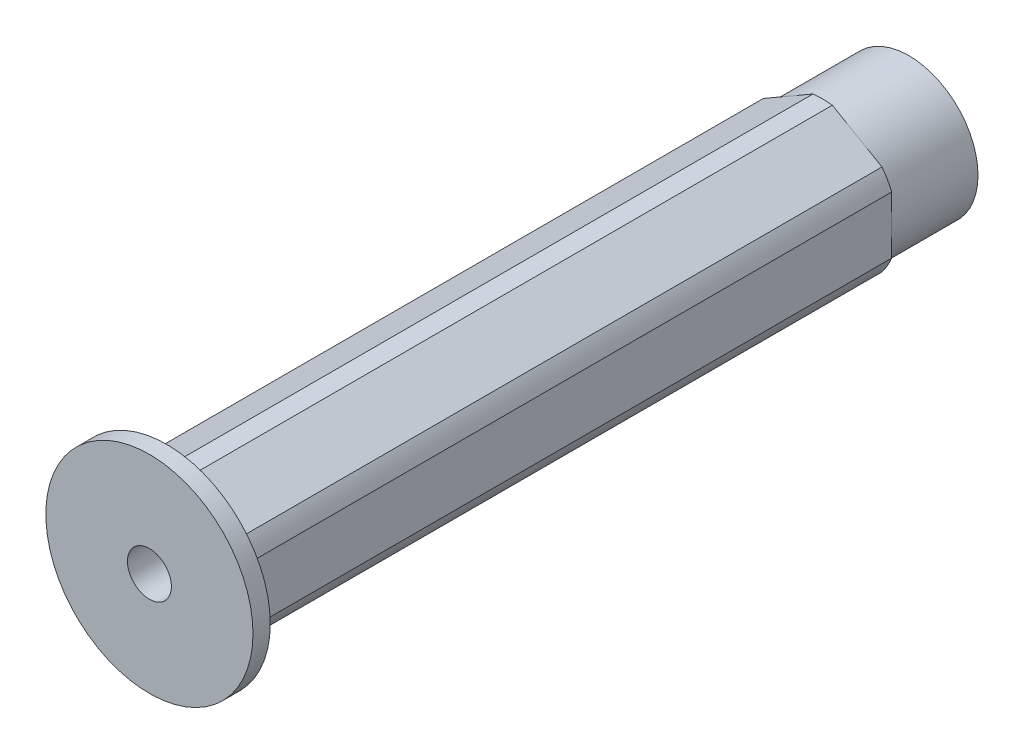
from build123d import *

# Parameters (mm, degrees)
BOSS_EXTRUDE1_DEPTH = 34.13125
SKETCH3_R           = 2.0193
CUT_EXTRUDE1_DEPTH  = 69.901066982
CUT_EXTRUDE3_START  = -7.9375
SKETCH8_R           = 6.875
SKETCH8_R_2         = 6.35
CUT_EXTRUDE3_DEPTH  = 7.9375
BOSS_EXTRUDE2_START = 1.5875
SKETCH9_R           = 9.525
SKETCH9_R_2         = 2.0193
BOSS_EXTRUDE2_DEPTH = 1.5875


with BuildPart() as part:
    # Sketch1 → Boss-Extrude1 (new, symmetric)
    with BuildSketch(Plane.XY):
        with BuildLine():
            Line((-0.893039494, 6.816751826), (-5.456960506, 4.181770802))
            ThreePointArc((-5.456960506, 4.181770802), (-5.953924651, 3.4375), (-6.35, 2.634981025))
            Line((-6.35, 2.634981025), (-6.35, -2.634981025))
            ThreePointArc((-6.35, -2.634981025), (-5.953924651, -3.4375), (-5.456960506, -4.181770802))
            Line((-5.456960506, -4.181770802), (-0.893039494, -6.816751826))
            ThreePointArc((-0.893039494, -6.816751826), (0, -6.875), (0.893039494, -6.816751826))
            Line((0.893039494, -6.816751826), (5.456960506, -4.181770802))
            ThreePointArc((5.456960506, -4.181770802), (5.953924651, -3.4375), (6.35, -2.634981025))
            Line((6.35, -2.634981025), (6.35, 2.634981025))
            ThreePointArc((6.35, 2.634981025), (5.953924651, 3.4375), (5.456960506, 4.181770802))
            Line((5.456960506, 4.181770802), (0.893039494, 6.816751826))
            ThreePointArc((0.893039494, 6.816751826), (0, 6.875), (-0.893039494, 6.816751826))
        make_face()
    extrude(amount=BOSS_EXTRUDE1_DEPTH, both=True)

    # Sketch3 → Cut-Extrude1 (cut, through all)
    with BuildSketch(Plane.XY.offset(34.13125)):
        Circle(SKETCH3_R)
    extrude(amount=-CUT_EXTRUDE1_DEPTH, mode=Mode.SUBTRACT)

    # Sketch8 → Cut-Extrude3 (cut)
    with BuildSketch(Plane(origin=(0, 0, -34.13125), x_dir=(-1, 0, 0), z_dir=(0, 0, -1)).offset(CUT_EXTRUDE3_START)):
        Circle(SKETCH8_R)
        Circle(SKETCH8_R_2, mode=Mode.SUBTRACT)
    extrude(amount=CUT_EXTRUDE3_DEPTH, mode=Mode.SUBTRACT)

    # Sketch9 → Boss-Extrude2 (add)
    with BuildSketch(Plane.XY.offset(34.13125).offset(BOSS_EXTRUDE2_START)):
        Circle(SKETCH9_R)
        Circle(SKETCH9_R_2, mode=Mode.SUBTRACT)
    extrude(amount=-BOSS_EXTRUDE2_DEPTH)


solid = part.part
